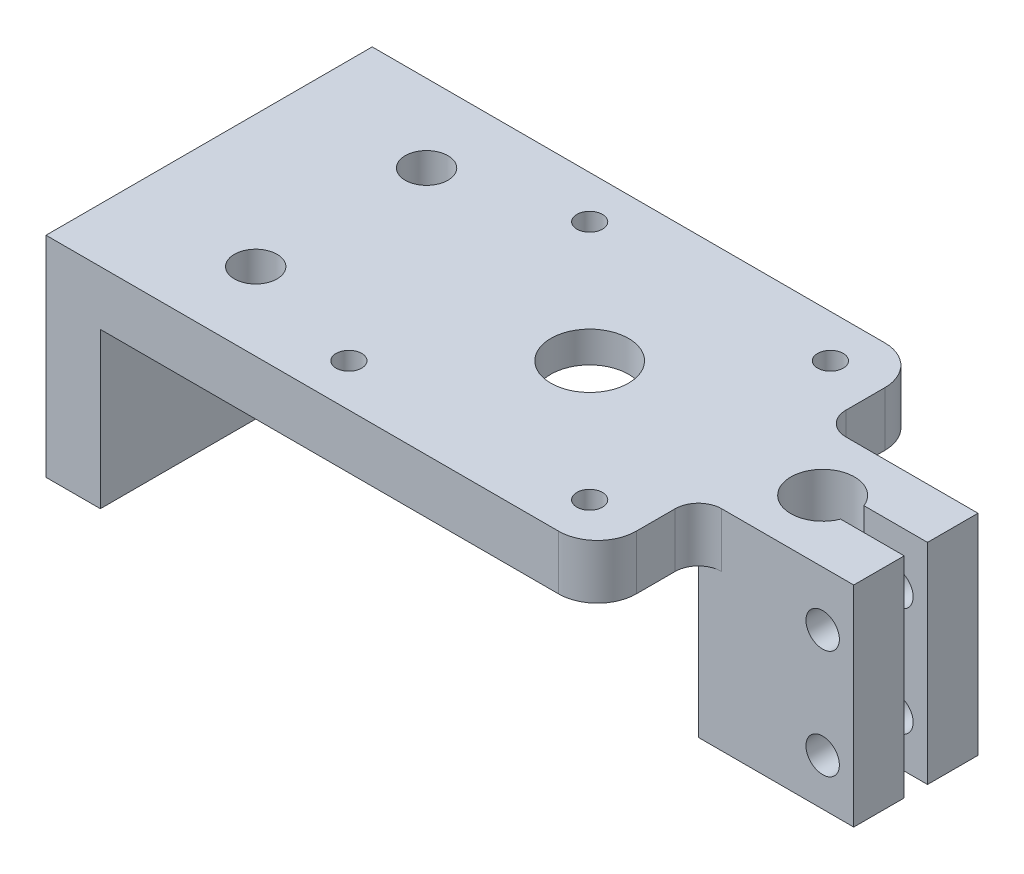
from build123d import *

# Parameters (mm, degrees)
SKETCH1_W                = 64
SKETCH1_H                = 42
BOSS_EXTRUDE1_DEPTH      = 7
BOSS_EXTRUDE3_DEPTH      = 7
BOSS_EXTRUDE3_DEPTH_BACK = 20
SKETCH11_W               = 20
SKETCH11_H               = 16
SKETCH3_R                = 12
CUT_EXTRUDE2_DEPTH       = 3
SKETCH2_R                = 4.1
CUT_EXTRUDE1_DEPTH       = 63.241465278
SKETCH4_R                = 2.75
CUT_EXTRUDE3_DEPTH       = 63.241465278
SKETCH7_R                = 1.65
CUT_EXTRUDE5_DEPTH       = 63.241465278
SKETCH8_W                = 42
SKETCH8_H                = 27
BOSS_EXTRUDE2_DEPTH      = 7
CUT_EXTRUDE6_DEPTH       = 96.509161864
CUT_EXTRUDE6_DEPTH_BACK  = 13
SKETCH9_R                = 2.7
SKETCH10_R               = 5
CUT_EXTRUDE7_DEPTH       = 20
SKETCH15_R               = 2.15
CUT_EXTRUDE8_DEPTH       = 22
SKETCH16_W               = 14
SKETCH16_H               = 3
CUT_EXTRUDE9_DEPTH       = 63.241465278
FILLET1_R                = 3
FILLET2_R                = 5


with BuildPart() as part:
    # Sketch1 → Boss-Extrude1 (new body)
    with BuildSketch(Plane(origin=(0, 0, 0), x_dir=(1, 0, 0), z_dir=(0, 1, 0))):
        Rectangle(SKETCH1_W, SKETCH1_H)
    extrude(amount=BOSS_EXTRUDE1_DEPTH)

    # Sketch11 → Boss-Extrude3 (add, two sides: drawn at the far end of the back side and taken through both)
    with BuildSketch(Plane(origin=(0, 0, 0), x_dir=(1, 0, 0), z_dir=(0, 1, 0)).offset(-BOSS_EXTRUDE3_DEPTH_BACK)):
        with Locations((42, 0)):
            Rectangle(SKETCH11_W, SKETCH11_H)
    extrude(amount=BOSS_EXTRUDE3_DEPTH + BOSS_EXTRUDE3_DEPTH_BACK)

    # Sketch3 → Cut-Extrude2 (cut)
    with BuildSketch(Plane(origin=(0, 0, 0), x_dir=(1, 0, 0), z_dir=(0, 1, 0))):
        with Locations((10, 0)):
            Circle(SKETCH3_R)
    extrude(amount=CUT_EXTRUDE2_DEPTH, mode=Mode.SUBTRACT)

    # Sketch2 → Cut-Extrude1 (cut, through all)
    with BuildSketch(Plane(origin=(0, 7, 0), x_dir=(1, 0, 0), z_dir=(0, 1, 0))):
        with Locations((40, 0)):
            Circle(SKETCH2_R)
    extrude(amount=-CUT_EXTRUDE1_DEPTH, mode=Mode.SUBTRACT)

    # Sketch4 → Cut-Extrude3 (cut, through all)
    with BuildSketch(Plane(origin=(0, 7, 0), x_dir=(1, 0, 0), z_dir=(0, 1, 0))):
        with Locations((-22, 11)):
            Circle(SKETCH4_R)
        with Locations((-22, -11)):
            Circle(SKETCH4_R)
    extrude(amount=-CUT_EXTRUDE3_DEPTH, mode=Mode.SUBTRACT)

    # Sketch7 → Cut-Extrude5 (cut, through all)
    with BuildSketch(Plane(origin=(0, 7, 0), x_dir=(1, 0, 0), z_dir=(0, 1, 0))):
        with Locations((-5.5, 15.5)):
            Circle(SKETCH7_R)
        with Locations((25.5, 15.5)):
            Circle(SKETCH7_R)
        with Locations((25.5, -15.5)):
            Circle(SKETCH7_R)
        with Locations((-5.5, -15.5)):
            Circle(SKETCH7_R)
    extrude(amount=-CUT_EXTRUDE5_DEPTH, mode=Mode.SUBTRACT)

    # Sketch8 → Boss-Extrude2 (add)
    with BuildSketch(Plane.ZY.offset(32)):
        with Locations((0, -6.5)):
            Rectangle(SKETCH8_W, SKETCH8_H)
    extrude(amount=BOSS_EXTRUDE2_DEPTH)

    # Sketch9 → Cut-Extrude6 (cut, two sides: drawn at the far end of the back side and taken through both)
    with BuildSketch(Plane.ZY.offset(39).offset(-CUT_EXTRUDE6_DEPTH_BACK)):
        with Locations((0, -10)):
            Circle(SKETCH9_R)
    extrude(amount=CUT_EXTRUDE6_DEPTH + CUT_EXTRUDE6_DEPTH_BACK, mode=Mode.SUBTRACT)

    # Sketch10 → Cut-Extrude7 (cut)
    with BuildSketch(Plane(origin=(0, 7, 0), x_dir=(1, 0, 0), z_dir=(0, 1, 0))):
        with Locations((10, 0)):
            Circle(SKETCH10_R)
    extrude(amount=-CUT_EXTRUDE7_DEPTH, mode=Mode.SUBTRACT)

    # Sketch15 → Cut-Extrude8 (cut)
    with BuildSketch(Plane(origin=(0, 0, -8), x_dir=(-1, 0, 0), z_dir=(0, 0, -1))):
        with Locations((-48, 0)):
            Circle(SKETCH15_R)
        with Locations((-48, -14)):
            Circle(SKETCH15_R)
    extrude(amount=-CUT_EXTRUDE8_DEPTH, mode=Mode.SUBTRACT)

    # Sketch16 → Cut-Extrude9 (cut, through all)
    with BuildSketch(Plane(origin=(0, 7, 0), x_dir=(1, 0, 0), z_dir=(0, 1, 0))):
        with Locations((45, 0)):
            Rectangle(SKETCH16_W, SKETCH16_H)
    extrude(amount=-CUT_EXTRUDE9_DEPTH, mode=Mode.SUBTRACT)

    # Fillet1
    fillet1_edges = [part.edges().sort_by_distance(p)[0] for p in [
        (32, 3.5, 8),
        (32, 3.5, -8),
    ]]
    fillet(fillet1_edges, radius=FILLET1_R)

    # Fillet2
    fillet2_edges = [part.edges().sort_by_distance(p)[0] for p in [
        (32, 3.5, -21),
        (32, 3.5, 21),
    ]]
    fillet(fillet2_edges, radius=FILLET2_R)


solid = part.part
